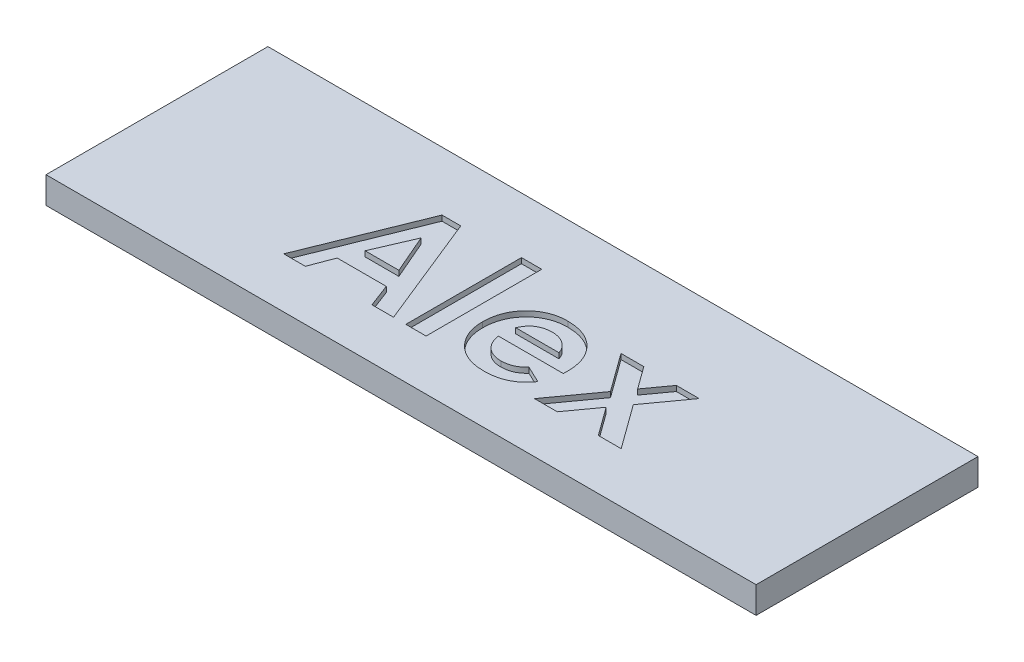
from build123d import *

# Parameters (mm, degrees)
SKETCH1_W           = 80
SKETCH1_H           = 25
BOSS_EXTRUDE1_DEPTH = 3
SKETCH2_R           = 2.25
CUT_EXTRUDE1_DEPTH  = 1.5
SKETCH3_W           = 2.27948718
SKETCH3_H           = 13.025641026
CUT_EXTRUDE2_DEPTH  = 0.6


with BuildPart() as part:
    # Sketch1 → Boss-Extrude1 (new body)
    with BuildSketch(Plane(origin=(0, 0, 0), x_dir=(1, 0, 0), z_dir=(0, 1, 0))):
        with Locations((21.96413767, -15.59699623)):
            Rectangle(SKETCH1_W, SKETCH1_H)
    extrude(amount=BOSS_EXTRUDE1_DEPTH)

    # Sketch2 → Cut-Extrude1 (cut)
    with BuildSketch(Plane.XZ):
        with Locations((-14.621648768, 24.682782668)):
            Circle(SKETCH2_R)
        with Locations((-14.621648768, 6.511209792)):
            Circle(SKETCH2_R)
        with Locations((54.549924108, 24.682782668)):
            Circle(SKETCH2_R)
        with Locations((54.549924108, 6.511209792)):
            Circle(SKETCH2_R)
    extrude(amount=-CUT_EXTRUDE1_DEPTH, mode=Mode.SUBTRACT)

    # Sketch3 → Cut-Extrude2 (cut)
    # profile 1 of 4: a face of its own
    with BuildSketch(Plane(origin=(0, 3, 0), x_dir=(1, 0, 0), z_dir=(0, 1, 0))):
        Polygon((8.208348407, -9.727676223), (10.322471003, -9.727676223), (15.451317157, -22.427676223), (13.016641676, -22.427676223), (12.029542317, -19.822548017), (6.496188952, -19.822548017), (5.509089593, -22.427676223), (3.076958183, -22.427676223), align=None)
        Polygon((9.26413767, -13.134186639), (7.361172926, -17.543060838), (11.167102414, -17.543060838), align=None, mode=Mode.SUBTRACT)
    # profile 2 of 4: a face of its own
    with BuildSketch(Plane(origin=(0, 3, 0), x_dir=(1, 0, 0), z_dir=(0, 1, 0))):
        with Locations((17.975035106, -15.91485571)):
            Rectangle(SKETCH3_W, SKETCH3_H)
    # profile 3 of 4: a face of its own
    with BuildSketch(Plane(origin=(0, 3, 0), x_dir=(1, 0, 0), z_dir=(0, 1, 0))):
        with BuildLine():
            Line((30.504582382, -18.357163402), (23.185291516, -18.357163402))
            add(Edge.make_bspline(
                [(23.185291516, -18.357163402), (23.200214959, -18.442209409), (23.229540702, -18.609331524), (23.293222596, -18.852090897), (23.374490242, -19.080863232), (23.4718844, -19.295954343), (23.583763002, -19.498501331), (23.714260123, -19.687554172), (23.861720525, -19.862945882), (24.025291631, -20.02391419), (24.202247009, -20.168145283), (24.39172849, -20.294500838), (24.593931607, -20.398104663), (24.806538177, -20.485431937), (25.031136861, -20.554603985), (25.268058212, -20.602310631), (25.516674186, -20.630491122), (25.686038983, -20.634567107), (25.772611228, -20.636650582)],
                knots=[0, 0, 0, 0, 1.091296461, 2.144483647, 3.168565212, 4.157007626, 5.126487748, 6.090021542, 7.05641414, 8.019231907, 8.98705074, 9.938580405, 10.892824166, 11.854447369, 12.841318655, 13.858982407, 14.905600794, 16, 16, 16, 16], degree=3))
            add(Edge.make_bspline(
                [(25.772611228, -20.636650582), (25.877109804, -20.633891718), (26.082898275, -20.628458704), (26.384379918, -20.580275935), (26.675956582, -20.507497981), (26.954868926, -20.399271054), (27.22434771, -20.264547555), (27.479956487, -20.096698653), (27.726119644, -19.90062944), (27.876308179, -19.749499366), (27.952879657, -19.672447857)],
                knots=[0, 0, 0, 0, 1.021034703, 2.010718019, 2.977989445, 3.954245119, 4.929443971, 5.918328161, 6.938689359, 8, 8, 8, 8], degree=3))
            Line((27.952879657, -19.672447857), (29.860932542, -20.58068103))
            add(Edge.make_bspline(
                [(29.860932542, -20.58068103), (29.80085861, -20.663693984), (29.681824324, -20.828181098), (29.487504847, -21.05965695), (29.284720099, -21.27563331), (29.073318844, -21.474689669), (28.853032972, -21.656258795), (28.624475264, -21.822552529), (28.384305445, -21.969105949), (28.137325665, -22.103009223), (27.878430396, -22.217803878), (27.608336115, -22.315696709), (27.328186824, -22.404190994), (27.034444841, -22.471618792), (26.729556154, -22.524994087), (26.412791409, -22.562897617), (26.084192354, -22.586308811), (25.860845492, -22.58908418), (25.747170523, -22.590496735)],
                knots=[0, 0, 0, 0, 1.028154879, 2.037251081, 3.030720504, 4.000128189, 4.949298328, 5.894184978, 6.834267904, 7.770992897, 8.712077017, 9.673380525, 10.653304757, 11.658697181, 12.695551717, 13.758623199, 14.859225354, 16, 16, 16, 16], degree=3))
            add(Edge.make_bspline(
                [(25.747170523, -22.590496735), (25.572283449, -22.586931314), (25.229777196, -22.579948642), (24.728799885, -22.515139452), (24.253010391, -22.407678829), (23.801065249, -22.261602617), (23.374918069, -22.068736254), (22.974357949, -21.832844693), (22.59538272, -21.558450448), (22.249572192, -21.239794713), (21.934528598, -20.892956891), (21.657813893, -20.520476753), (21.426262969, -20.12495668), (21.236108693, -19.709014304), (21.088314183, -19.271584977), (20.981762915, -18.812477814), (20.916445711, -18.331912091), (20.909391129, -18.004593189), (20.905804337, -17.838173017)],
                knots=[0, 0, 0, 0, 1.103565453, 2.161269334, 3.182010356, 4.179077853, 5.15417608, 6.128274628, 7.109042802, 8.101804412, 9.090965879, 10.063106201, 11.02526161, 11.978650795, 12.945248442, 13.93468508, 14.949922959, 16, 16, 16, 16], degree=3))
            add(Edge.make_bspline(
                [(20.905804337, -17.838173017), (20.90942643, -17.667523896), (20.916552737, -17.331779412), (20.981200534, -16.840117207), (21.088608761, -16.371004964), (21.236835602, -15.923796664), (21.424105214, -15.497093634), (21.658602227, -15.094629011), (21.934391279, -14.715001634), (22.248299935, -14.359987439), (22.595575424, -14.039548341), (22.96458844, -13.753973068), (23.359485224, -13.516012794), (23.775799152, -13.323741041), (24.21086733, -13.167525095), (24.669718539, -13.063576429), (25.14886162, -12.993781123), (25.47639328, -12.987353411), (25.642863632, -12.984086479)],
                knots=[0, 0, 0, 0, 1.079208495, 2.12329425, 3.130605359, 4.119693003, 5.099659317, 6.073216462, 7.060498243, 8.06384408, 9.066070512, 10.045757761, 11.010926815, 11.975797609, 12.942977511, 13.929384301, 14.947594487, 16, 16, 16, 16], degree=3))
            add(Edge.make_bspline(
                [(25.642863632, -12.984086479), (25.818588533, -12.987707215), (26.163606266, -12.994816157), (26.66807273, -13.059099112), (27.147021409, -13.167215017), (27.602492893, -13.312028135), (28.028670625, -13.509766505), (28.434919021, -13.739853148), (28.811493942, -14.020178633), (29.162409274, -14.337274969), (29.479182079, -14.689082364), (29.756076609, -15.071252947), (29.991679775, -15.480056956), (30.182638479, -15.917152179), (30.33028123, -16.381226412), (30.436931131, -16.871676966), (30.501750121, -17.390369277), (30.508673433, -17.745547631), (30.512214593, -17.927215485)],
                knots=[0, 0, 0, 0, 1.080001299, 2.120471247, 3.119684163, 4.095710327, 5.052285597, 6.002875087, 6.961153713, 7.931888285, 8.906493152, 9.865905668, 10.82813294, 11.801621613, 12.7925306, 13.817193356, 14.883530496, 16, 16, 16, 16], degree=3))
            Line((30.512214593, -17.927215485), (30.504582382, -18.357163402))
        make_face()
        with BuildLine():
            add(Edge.make_bspline(
                [(28.232727414, -16.566137761), (28.189712096, -16.450056845), (28.10418644, -16.219257743), (27.910987542, -15.900811299), (27.654618786, -15.625023745), (27.356443531, -15.380866836), (27.015759632, -15.182693839), (26.643302634, -15.039210152), (26.243780323, -14.953175533), (25.968930502, -14.943085184), (25.828580779, -14.937932633)],
                knots=[0, 0, 0, 0, 0.954238005, 1.897273737, 2.851915805, 3.847685534, 4.862635127, 5.880135777, 6.917509367, 8, 8, 8, 8], degree=3))
            add(Edge.make_bspline(
                [(25.828580779, -14.937932633), (25.67529603, -14.942882285), (25.375656264, -14.952557826), (24.943446302, -15.055460748), (24.535753459, -15.209040286), (24.295400866, -15.36738405), (24.174934946, -15.446746735)],
                knots=[0, 0, 0, 0, 1.044195649, 2.041185066, 3.018232172, 4, 4, 4, 4], degree=3))
            add(Edge.make_bspline(
                [(24.174934946, -15.446746735), (24.099773209, -15.507191095), (23.939532227, -15.63605538), (23.731426804, -15.893127394), (23.52644123, -16.204383894), (23.409895629, -16.440805195), (23.348112029, -16.566137761)],
                knots=[0, 0, 0, 0, 0.82159062, 1.751589201, 2.808063854, 4, 4, 4, 4], degree=3))
            Line((23.348112029, -16.566137761), (28.232727414, -16.566137761))
        make_face(mode=Mode.SUBTRACT)
    # profile 4 of 4: a face of its own
    with BuildSketch(Plane(origin=(0, 3, 0), x_dir=(1, 0, 0), z_dir=(0, 1, 0))):
        Polygon((31.791882061, -13.146906992), (34.363937349, -13.146906992), (36.198212189, -15.675713082), (38.024854817, -13.146906992), (40.596910106, -13.146906992), (37.488055939, -17.45401837), (41.095547926, -22.427676223), (38.523492638, -22.427676223), (36.205844401, -19.232323659), (33.898372446, -22.427676223), (31.326317157, -22.427676223), (34.916000651, -17.45401837), align=None)
    extrude(amount=-CUT_EXTRUDE2_DEPTH, mode=Mode.SUBTRACT)


solid = part.part
